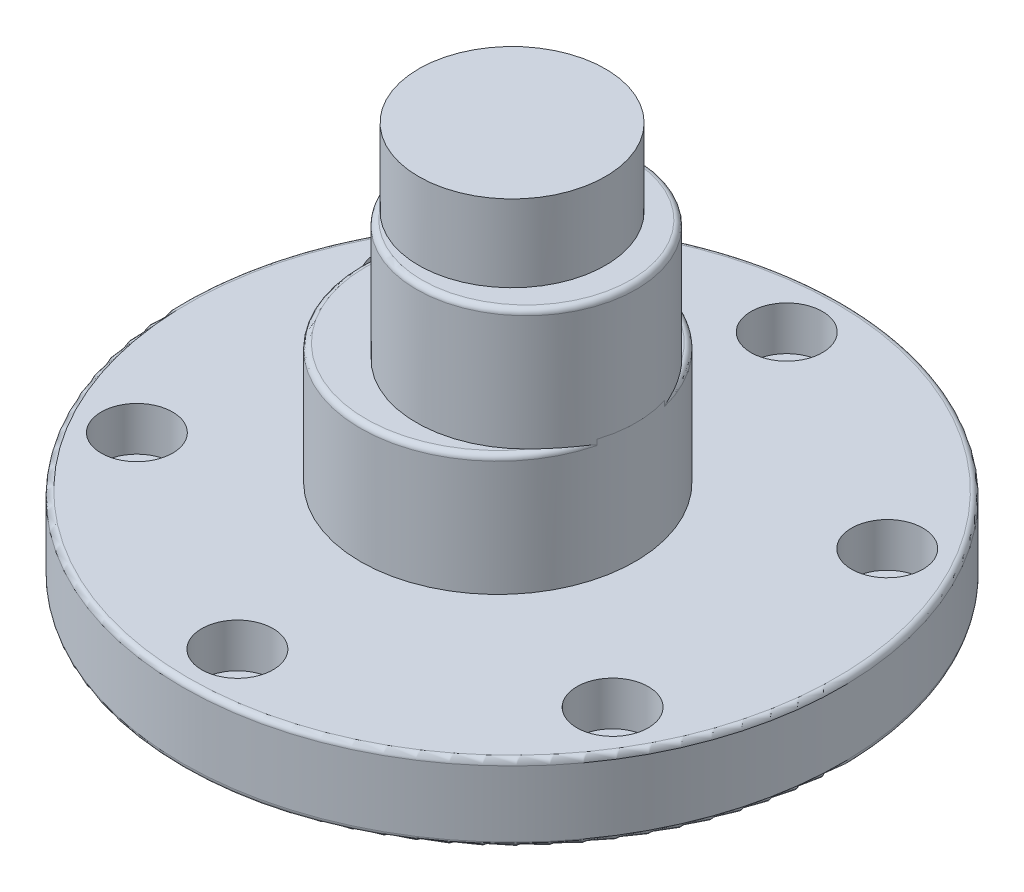
from build123d import *

# Parameters (mm, degrees)
SKETCH1_R           = 30
SKETCH1_R_2         = 2.05
BOSS_EXTRUDE1_DEPTH = 7
SKETCH2_R           = 12.5
BOSS_EXTRUDE2_DEPTH = 11
SKETCH3_R           = 10
BOSS_EXTRUDE3_DEPTH = 11
FILLET1_R           = 0.5
SKETCH4_R           = 3.25
CUT_EXTRUDE1_DEPTH  = 4
SKETCH5_R           = 8.5
BOSS_EXTRUDE4_DEPTH = 7


with BuildPart() as part:
    # Sketch1 → Boss-Extrude1 (new body)
    with BuildSketch(Plane(origin=(0, 0, 0), x_dir=(1, 0, 0), z_dir=(0, 1, 0))):
        Circle(SKETCH1_R)
        with Locations((0, 25)):
            Circle(SKETCH1_R_2, mode=Mode.SUBTRACT)
        with Locations((21.650635095, 12.5)):
            Circle(SKETCH1_R_2, mode=Mode.SUBTRACT)
        with Locations((21.650635095, -12.5)):
            Circle(SKETCH1_R_2, mode=Mode.SUBTRACT)
        with Locations((0, -25)):
            Circle(SKETCH1_R_2, mode=Mode.SUBTRACT)
        with Locations((-21.650635095, -12.5)):
            Circle(SKETCH1_R_2, mode=Mode.SUBTRACT)
        with Locations((-21.650635095, 12.5)):
            Circle(SKETCH1_R_2, mode=Mode.SUBTRACT)
    extrude(amount=BOSS_EXTRUDE1_DEPTH)

    # Sketch2 → Boss-Extrude2 (add)
    with BuildSketch(Plane(origin=(0, 7, 0), x_dir=(1, 0, 0), z_dir=(0, 1, 0))):
        with Locations((-1.3, 0)):
            Circle(SKETCH2_R)
    extrude(amount=BOSS_EXTRUDE2_DEPTH)

    # Sketch3 → Boss-Extrude3 (add)
    with BuildSketch(Plane(origin=(0, 18, 0), x_dir=(1, 0, 0), z_dir=(0, 1, 0))):
        with Locations((1.3, 0)):
            Circle(SKETCH3_R)
    extrude(amount=BOSS_EXTRUDE3_DEPTH)

    # Fillet1
    fillet1_edges = [part.edges().sort_by_distance(p)[0] for p in [
        (-8.7, 29, 0),
        (-13.8, 18, 0),
        (-30, 0, 0),
        (-30, 7, 0),
    ]]
    fillet(fillet1_edges, radius=FILLET1_R)

    # Sketch4 → Cut-Extrude1 (cut)
    with BuildSketch(Plane(origin=(0, 7, 0), x_dir=(1, 0, 0), z_dir=(0, 1, 0))):
        with Locations((0, 25)):
            Circle(SKETCH4_R)
        with Locations((21.650635095, 12.5)):
            Circle(SKETCH4_R)
        with Locations((21.650635095, -12.5)):
            Circle(SKETCH4_R)
        with Locations((0, -25)):
            Circle(SKETCH4_R)
        with Locations((-21.650635095, -12.5)):
            Circle(SKETCH4_R)
        with Locations((-21.650635095, 12.5)):
            Circle(SKETCH4_R)
    extrude(amount=-CUT_EXTRUDE1_DEPTH, mode=Mode.SUBTRACT)

    # Sketch5 → Boss-Extrude4 (add)
    with BuildSketch(Plane(origin=(0, 29, 0), x_dir=(1, 0, 0), z_dir=(0, 1, 0))):
        Circle(SKETCH5_R)
    extrude(amount=BOSS_EXTRUDE4_DEPTH)


solid = part.part
